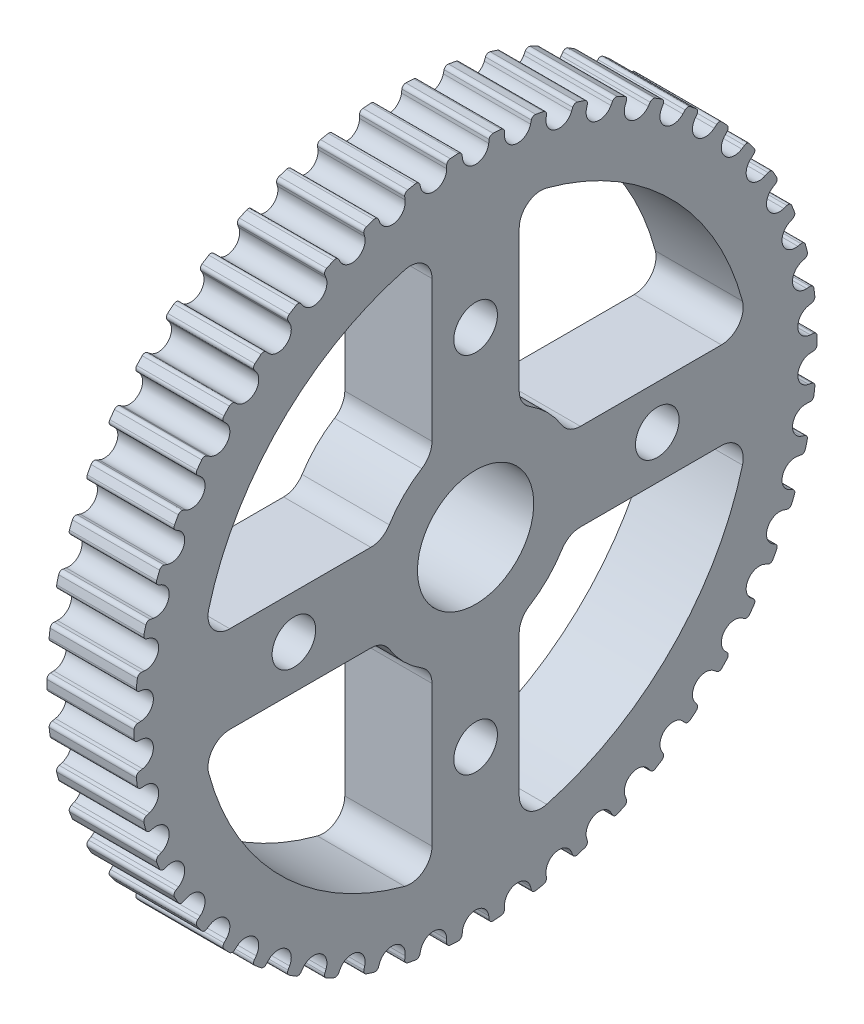
from build123d import *

# Parameters (mm, degrees)
CHAMFER_1_SIZE           = 1
SKETCH_4_W               = 4
SKETCH_4_H               = 1.799999952
CUT_EXTRUDE_1_DEPTH      = 34.996706782
CUT_EXTRUDE_2_REACH      = 35.997
PATTERN_CIRCULAR_3_COUNT = 50
SKETCH_7_R               = 14
CUT_EXTRUDE_3_DEPTH      = 10
SKETCH_8_R               = 7.325675341
EXTRUDE_1_DEPTH          = 6
CUT_EXTRUDE_4_REACH      = 35.742
SKETCH_9_R               = 4
CUT_EXTRUDE_5_REACH      = 35.742
SKETCH_10_R              = 1.5
CUT_EXTRUDE_6_REACH      = 35.742
FILLET_1_R               = 1.5


with BuildPart() as part:
    # 草图1 → 旋转1 (revolve)
    with BuildSketch(Plane.XY, mode=Mode.PRIVATE) as revolve_1_sk:
        Polygon((0, 5.6156), (0, 23.494), (6, 23.494), (6, 11.2312), (7.2, 11.2312), (7.2, 5.6156), align=None)
    revolve(revolve_1_sk.sketch.rotate(Axis((0, 0, 0), (1, 0, 0)), 90), axis=Axis((0, 0, 0), (1, 0, 0)))

    # 倒角1
    chamfer_1_edges = [part.edges().sort_by_distance(p)[0] for p in [
        (7.2, 0, -5.6156),
        (0, 0, -5.6156),
    ]]
    chamfer(chamfer_1_edges, length=CHAMFER_1_SIZE)

    # 草图4 → 切除-拉伸1 (cut, through all)
    with BuildSketch(Plane.ZY):
        with Locations((0, 6.147376784)):
            Rectangle(SKETCH_4_W, SKETCH_4_H)
    extrude(amount=-CUT_EXTRUDE_1_DEPTH, mode=Mode.SUBTRACT)

    # 草图6 → 切除-拉伸2 (cut, up to next)
    with BuildSketch(Plane(origin=(0, 0, 0), x_dir=(0, 0, -1), z_dir=(1, 0, 0)), mode=Mode.PRIVATE) as cut_extrude_2_sk1:
        with BuildLine():
            Line((0.930495591, 23.235265211), (0.903216998, 23.013098898))
            ThreePointArc((0.903216998, 23.013098898), (0, 22.214), (-0.903216998, 23.013098898))
            Line((-0.903216998, 23.013098898), (-0.930495591, 23.235265211))
            ThreePointArc((-0.930495591, 23.235265211), (-1.021315173, 23.402651967), (-1.20185814, 23.463238758))
            ThreePointArc((-1.20185814, 23.463238758), (-1.331669529, 23.456229285), (-1.461440145, 23.44850163))
            Line((-1.461440145, 23.44850163), (-1.658088133, 25.050070972))
            ThreePointArc((-1.658088133, 25.050070972), (0, 25.104886217), (1.658088133, 25.050070972))
            Line((1.658088133, 25.050070972), (1.461440145, 23.44850163))
            ThreePointArc((1.461440145, 23.44850163), (1.331669529, 23.456229285), (1.20185814, 23.463238758))
            ThreePointArc((1.20185814, 23.463238758), (1.021315173, 23.402651967), (0.930495591, 23.235265211))
        make_face()
    cut_extrude_2_tool1 = extrude(cut_extrude_2_sk1.sketch, amount=CUT_EXTRUDE_2_REACH, mode=Mode.PRIVATE) & part.part
    cut_extrude_2 = cut_extrude_2_tool1.solids().sort_by_distance((0, 23.91152, 0))[0]
    add(cut_extrude_2, mode=Mode.SUBTRACT)

    # 阵列(圆周)3: 切除-拉伸2 ×50 about axis
    pattern_circular_3_axis = Axis((0, 0, 0), (1, 0, 0))
    for i in range(1, PATTERN_CIRCULAR_3_COUNT):
        add(cut_extrude_2.rotate(pattern_circular_3_axis, i * 360 / PATTERN_CIRCULAR_3_COUNT), mode=Mode.SUBTRACT)

    # 草图7 → 切除-拉伸3 (cut)
    with BuildSketch(Plane(origin=(6, 0, 0), x_dir=(0, 0, -1), z_dir=(1, 0, 0))):
        Circle(SKETCH_7_R)
    extrude(amount=CUT_EXTRUDE_3_DEPTH, mode=Mode.SUBTRACT)

    # 草图8 → 凸台-拉伸1 (add)
    with BuildSketch(Plane(origin=(6, 0, 0), x_dir=(0, 0, -1), z_dir=(1, 0, 0))):
        Circle(SKETCH_8_R)
    extrude(amount=-EXTRUDE_1_DEPTH)

    # 草图9 → 切除-拉伸4 (cut, up to next)
    with BuildSketch(Plane.ZY, mode=Mode.PRIVATE) as cut_extrude_4_sk1:
        Circle(SKETCH_9_R)
    cut_extrude_4_tool1 = extrude(cut_extrude_4_sk1.sketch, amount=-CUT_EXTRUDE_4_REACH, mode=Mode.PRIVATE) & part.part
    add(cut_extrude_4_tool1.solids().sort_by_distance((0, 0, 0))[0], mode=Mode.SUBTRACT)

    # 草图10 → 切除-拉伸5 (cut, up to next)
    with BuildSketch(Plane(origin=(6, 0, 0), x_dir=(0, 0, -1), z_dir=(1, 0, 0)), mode=Mode.PRIVATE) as cut_extrude_5_sk1:
        with Locations((0, 12.5)):
            Circle(SKETCH_10_R)
    cut_extrude_5_tool1 = extrude(cut_extrude_5_sk1.sketch, amount=-CUT_EXTRUDE_5_REACH, mode=Mode.PRIVATE) & part.part
    # 草图10 → 切除-拉伸5 (cut, up to next)
    with BuildSketch(Plane(origin=(6, 0, 0), x_dir=(0, 0, -1), z_dir=(1, 0, 0)), mode=Mode.PRIVATE) as cut_extrude_5_sk2:
        with Locations((0, -12.5)):
            Circle(SKETCH_10_R)
    cut_extrude_5_tool2 = extrude(cut_extrude_5_sk2.sketch, amount=-CUT_EXTRUDE_5_REACH, mode=Mode.PRIVATE) & part.part
    # 草图10 → 切除-拉伸5 (cut, up to next)
    with BuildSketch(Plane(origin=(6, 0, 0), x_dir=(0, 0, -1), z_dir=(1, 0, 0)), mode=Mode.PRIVATE) as cut_extrude_5_sk3:
        with Locations((12.5, 0)):
            Circle(SKETCH_10_R)
    cut_extrude_5_tool3 = extrude(cut_extrude_5_sk3.sketch, amount=-CUT_EXTRUDE_5_REACH, mode=Mode.PRIVATE) & part.part
    # 草图10 → 切除-拉伸5 (cut, up to next)
    with BuildSketch(Plane(origin=(6, 0, 0), x_dir=(0, 0, -1), z_dir=(1, 0, 0)), mode=Mode.PRIVATE) as cut_extrude_5_sk4:
        with Locations((-12.5, 0)):
            Circle(SKETCH_10_R)
    cut_extrude_5_tool4 = extrude(cut_extrude_5_sk4.sketch, amount=-CUT_EXTRUDE_5_REACH, mode=Mode.PRIVATE) & part.part
    add(cut_extrude_5_tool1.solids().sort_by_distance((6, 12.5, 0))[0], mode=Mode.SUBTRACT)
    add(cut_extrude_5_tool2.solids().sort_by_distance((6, -12.5, 0))[0], mode=Mode.SUBTRACT)
    add(cut_extrude_5_tool3.solids().sort_by_distance((6, 0, -12.5))[0], mode=Mode.SUBTRACT)
    add(cut_extrude_5_tool4.solids().sort_by_distance((6, 0, 12.5))[0], mode=Mode.SUBTRACT)

    # 草图11 → 切除-拉伸6 (cut, up to next)
    with BuildSketch(Plane(origin=(6, 0, 0), x_dir=(0, 0, -1), z_dir=(1, 0, 0)), mode=Mode.PRIVATE) as cut_extrude_6_sk1:
        with BuildLine():
            ThreePointArc((-6.32455532, 3), (-4.949747468, 4.949747468), (-3, 6.32455532))
            Line((-3, 6.32455532), (-3, 18.761663039))
            ThreePointArc((-3, 18.761663039), (-13.435028843, 13.435028843), (-18.761663039, 3))
            Line((-18.761663039, 3), (-6.32455532, 3))
        make_face()
    cut_extrude_6_tool1 = extrude(cut_extrude_6_sk1.sketch, amount=-CUT_EXTRUDE_6_REACH, mode=Mode.PRIVATE) & part.part
    # 草图11 → 切除-拉伸6 (cut, up to next)
    with BuildSketch(Plane(origin=(6, 0, 0), x_dir=(0, 0, -1), z_dir=(1, 0, 0)), mode=Mode.PRIVATE) as cut_extrude_6_sk2:
        with BuildLine():
            Line((3, 18.761663039), (3, 6.32455532))
            ThreePointArc((3, 6.32455532), (4.949747468, 4.949747468), (6.32455532, 3))
            Line((6.32455532, 3), (18.761663039, 3))
            ThreePointArc((18.761663039, 3), (13.435028843, 13.435028843), (3, 18.761663039))
        make_face()
    cut_extrude_6_tool2 = extrude(cut_extrude_6_sk2.sketch, amount=-CUT_EXTRUDE_6_REACH, mode=Mode.PRIVATE) & part.part
    # 草图11 → 切除-拉伸6 (cut, up to next)
    with BuildSketch(Plane(origin=(6, 0, 0), x_dir=(0, 0, -1), z_dir=(1, 0, 0)), mode=Mode.PRIVATE) as cut_extrude_6_sk3:
        with BuildLine():
            ThreePointArc((6.32455532, -3), (4.949747468, -4.949747468), (3, -6.32455532))
            Line((3, -6.32455532), (3, -18.761663039))
            ThreePointArc((3, -18.761663039), (13.435028843, -13.435028843), (18.761663039, -3))
            Line((18.761663039, -3), (6.32455532, -3))
        make_face()
    cut_extrude_6_tool3 = extrude(cut_extrude_6_sk3.sketch, amount=-CUT_EXTRUDE_6_REACH, mode=Mode.PRIVATE) & part.part
    # 草图11 → 切除-拉伸6 (cut, up to next)
    with BuildSketch(Plane(origin=(6, 0, 0), x_dir=(0, 0, -1), z_dir=(1, 0, 0)), mode=Mode.PRIVATE) as cut_extrude_6_sk4:
        with BuildLine():
            Line((-3, -18.761663039), (-3, -6.32455532))
            ThreePointArc((-3, -6.32455532), (-4.949747468, -4.949747468), (-6.32455532, -3))
            Line((-6.32455532, -3), (-18.761663039, -3))
            ThreePointArc((-18.761663039, -3), (-13.435028843, -13.435028843), (-3, -18.761663039))
        make_face()
    cut_extrude_6_tool4 = extrude(cut_extrude_6_sk4.sketch, amount=-CUT_EXTRUDE_6_REACH, mode=Mode.PRIVATE) & part.part
    add(cut_extrude_6_tool1.solids().sort_by_distance((6, 9.576535, 9.576535))[0], mode=Mode.SUBTRACT)
    add(cut_extrude_6_tool2.solids().sort_by_distance((6, 9.576535, -9.576535))[0], mode=Mode.SUBTRACT)
    add(cut_extrude_6_tool3.solids().sort_by_distance((6, -9.576535, -9.576535))[0], mode=Mode.SUBTRACT)
    add(cut_extrude_6_tool4.solids().sort_by_distance((6, -9.576535, 9.576535))[0], mode=Mode.SUBTRACT)

    # 圆角1
    fillet_1_edges = [part.edges().sort_by_distance(p)[0] for p in [
        (3, -3, 6.32455532),
        (3, -6.32455532, 3),
        (3, -18.761663039, 3),
        (3, -3, 18.761663039),
        (3, -6.32455532, -3),
        (3, -3, -6.32455532),
        (3, -3, -18.761663039),
        (3, -18.761663039, -3),
        (3, 3, -6.32455532),
        (3, 6.32455532, -3),
        (3, 18.761663039, -3),
        (3, 3, -18.761663039),
        (3, 6.32455532, 3),
        (3, 3, 6.32455532),
        (3, 3, 18.761663039),
        (3, 18.761663039, 3),
    ]]
    fillet(fillet_1_edges, radius=FILLET_1_R)


solid = part.part
